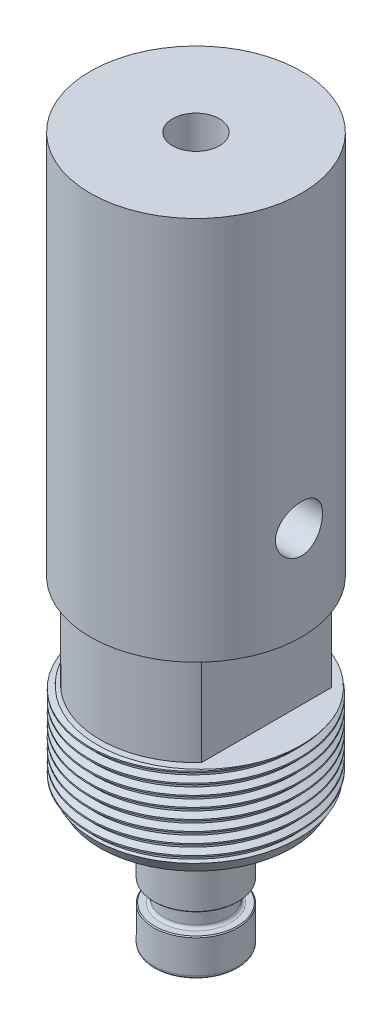
from build123d import *

# Parameters (mm, degrees)
FILLET1_R               = 0.508
CHAMFER1_SIZE           = 0.127
FILLET2_R               = 0.4064
THREAD1_PITCH           = 1.411111111
CUT_EXTRUDE1_DEPTH      = 98.36954253
CUT_EXTRUDE1_DEPTH_BACK = 98.36954253
SKETCH6_W               = 9.726380085
SKETCH6_H               = 12.7
SKETCH6_W_2             = 8.48079786


with BuildPart() as part:
    # Sketch1 → Revolve1 (revolve)
    with BuildSketch(Plane.XY, mode=Mode.PRIVATE) as revolve1_sk:
        Polygon((1.27, 0), (1.27, 87.14023638), (2.286, 88.9), (3.175, 88.9), (3.175, 95.25), (14.2875, 95.25), (14.2875, 43.2816), (12.954, 43.2816), (12.954, 30.5816), (14.224, 30.5816), (14.224, 20.081304526), (12.954, 17.8816), (10.16, 17.8816), (10.16, 19.3548), (5.715, 19.3548), (5.715, 7.8994), (4.3434, 7.8994), (4.3434, 5.08), (5.715, 5.08), (5.715, 0), align=None)
    revolve(revolve1_sk.sketch.rotate(Axis((0, 50.65788106, 0), (0, -1, 0)), 90), axis=Axis((0, 50.65788106, 0), (0, -1, 0)))

    # Fillet1
    fillet1_edges = [part.edges().sort_by_distance(p)[0] for p in [
        (0, 0, -5.715),
    ]]
    fillet(fillet1_edges, radius=FILLET1_R)

    # Chamfer1
    chamfer1_edges = [part.edges().sort_by_distance(p)[0] for p in [
        (0, 5.08, -5.715),
        (0, 7.8994, -5.715),
        (0, 17.8816, -10.16),
    ]]
    chamfer(chamfer1_edges, length=CHAMFER1_SIZE)

    # Fillet2
    fillet2_edges = [part.edges().sort_by_distance(p)[0] for p in [
        (0, 5.08, -4.3434),
        (0, 7.8994, -4.3434),
        (0, 19.3548, -5.715),
        (0, 19.3548, -10.16),
    ]]
    fillet(fillet2_edges, radius=FILLET2_R)

    # Thread1: the profile of Thread Profile1 profile screwed along a right-hand helix of 12.486614 turns, 8 arcs to a turn; built about Z, then put on its axis
    thread1_z = Axis((0, 0, 0), (0, 0, 1))
    thread1_corners = [(14.2243, 0, -0.000173205), (14.2243, 0, 1.234895423), (13.46021371, 0, 0.793749998), (13.46021371, 0, 0.44097222)]
    with BuildLine(mode=Mode.PRIVATE) as thread1_profile:
        Line(thread1_corners[0], thread1_corners[1])
        Line(thread1_corners[1], thread1_corners[2])
        Line(thread1_corners[2], thread1_corners[3])
        Line(thread1_corners[3], thread1_corners[0])
    thread1_cap = Face(thread1_profile.wire())
    thread1_turn_angles = [0, 22.5, 45, 67.5, 90, 112.5, 135, 157.5, 180, 202.5, 225, 247.5, 270, 292.5, 315, 337.5, 360]
    thread1_turn_weights = [1, 0.9238795325112867, 1, 0.9238795325112867, 1, 0.9238795325112867, 1, 0.9238795325112867, 1, 0.9238795325112867, 1, 0.9238795325112867, 1, 0.9238795325112867, 1, 0.9238795325112867, 1]
    thread1_turn_rails = [Edge.make_bspline([Vector(p[0], p[1], 0).rotate(thread1_z, thread1_turn_angles[k]) / thread1_turn_weights[k] + Vector(0, 0, p[2] + THREAD1_PITCH * thread1_turn_angles[k] / 360) for k in range(17)], [0, 0, 0, 1, 1, 2, 2, 3, 3, 4, 4, 5, 5, 6, 6, 7, 7, 8, 8, 8], 2, thread1_turn_weights) for p in thread1_corners]
    thread1_turn_sides = [Face.make_surface_from_curves(thread1_turn_rails[p[0]], thread1_turn_rails[p[1]]) for p in [(0, 1), (1, 2), (2, 3), (3, 0)]]
    thread1_last_angles = [4320, 4342.5, 4365, 4387.5, 4410, 4432.5, 4455, 4475.090551181, 4495.181102362]
    thread1_last_weights = [1, 0.9238795325112867, 1, 0.9238795325112867, 1, 0.9238795325112867, 1, 0.9391509132757836, 1]
    thread1_last_rails = [Edge.make_bspline([Vector(p[0], p[1], 0).rotate(thread1_z, thread1_last_angles[k]) / thread1_last_weights[k] + Vector(0, 0, p[2] + THREAD1_PITCH * thread1_last_angles[k] / 360) for k in range(9)], [0, 0, 0, 1, 1, 2, 2, 3, 3, 4, 4, 4], 2, thread1_last_weights) for p in thread1_corners]
    thread1_last_sides = [Face.make_surface_from_curves(thread1_last_rails[p[0]], thread1_last_rails[p[1]]) for p in [(0, 1), (1, 2), (2, 3), (3, 0)]]
    thread1 = Plane(origin=(0, 16.541304526, 0), x_dir=(1, 0, 0), z_dir=(0, 1, 0)) * Solid(Shell([*[p.moved(Location((0, 0, THREAD1_PITCH * i))) for i in range(12) for p in thread1_turn_sides], *thread1_last_sides, thread1_cap, thread1_cap.rotate(thread1_z, 4495.181102362).moved(Location((0, 0, THREAD1_PITCH * 4495.181102362 / 360)))]))
    add(thread1, mode=Mode.SUBTRACT)

    # Sketch6 → Cut-Extrude1 (cut, two sides: drawn at the far end of the back side and taken through both)
    with BuildSketch(Plane.XY.offset(-CUT_EXTRUDE1_DEPTH_BACK)):
        with Locations((14.388190042, 36.9316)):
            Rectangle(SKETCH6_W, SKETCH6_H)
        with Locations((-13.76539893, 36.9316)):
            Rectangle(SKETCH6_W_2, SKETCH6_H)
    extrude(amount=CUT_EXTRUDE1_DEPTH + CUT_EXTRUDE1_DEPTH_BACK, mode=Mode.SUBTRACT)

    # Sketch7 → Cut-Revolve1 (revolve, cut)
    with BuildSketch(Plane.XY, mode=Mode.PRIVATE) as cut_revolve1_sk:
        Polygon((-17.090929181, 88.265), (-7.9375, 88.265), (-7.9375, 86.36), (0, 86.36), (0, 85.09), (-17.090929181, 85.09), align=None)
    revolve(cut_revolve1_sk.sketch.rotate(Axis((0, 85.09, 0), (-1, 0, 0)), 90), axis=Axis((0, 85.09, 0), (-1, 0, 0)), mode=Mode.SUBTRACT)

    # Sketch8 → Cut-Revolve2 (revolve, cut)
    with BuildSketch(Plane.XY, mode=Mode.PRIVATE) as cut_revolve2_sk:
        Polygon((-18.243659951, 55.9816), (-18.243659951, 59.1566), (-7.9375, 59.1566), (-7.9375, 57.2516), (7.9375, 57.2516), (7.9375, 59.1566), (18.574705556, 59.1566), (18.574705556, 55.9816), align=None)
    revolve(cut_revolve2_sk.sketch.rotate(Axis((-19.482326815, 55.9816, 0), (1, 0, 0)), 90), axis=Axis((-19.482326815, 55.9816, 0), (1, 0, 0)), mode=Mode.SUBTRACT)


solid = part.part
